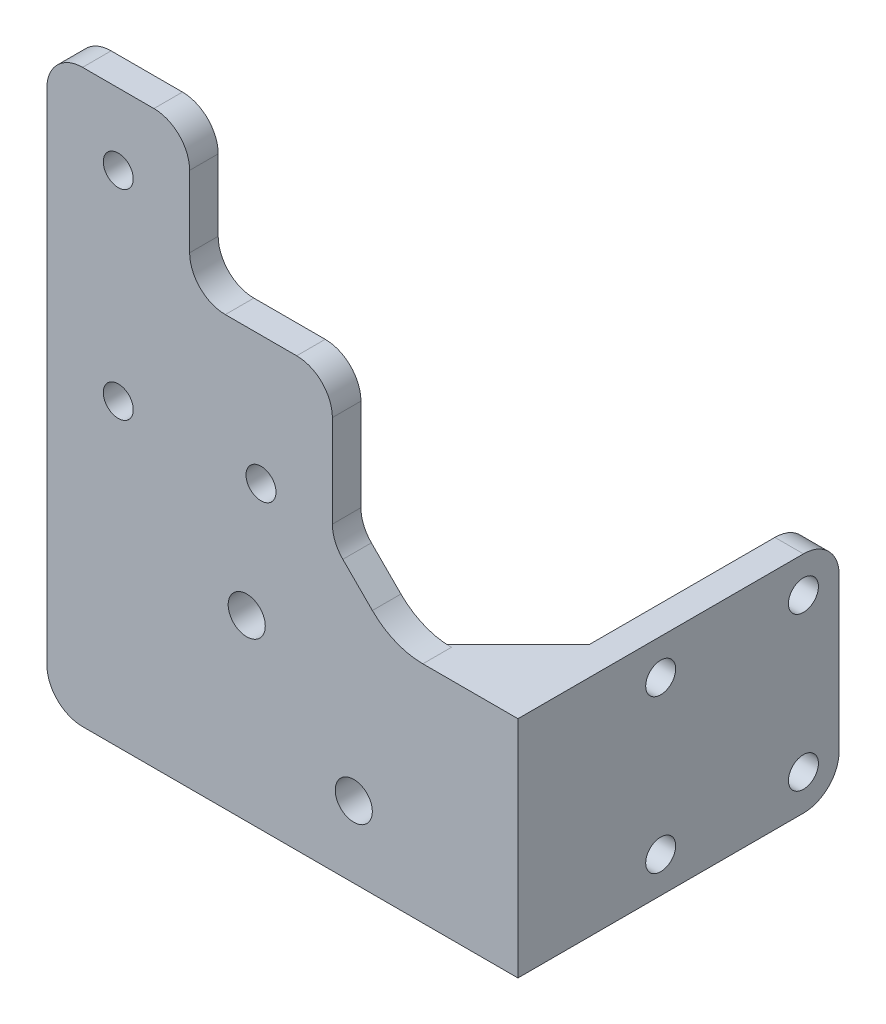
from build123d import *

# Parameters (mm, degrees)
MODEL_R         = 2.5999948
MODEL_R_2       = 2.0999958
EXTRUDE_1_DEPTH = 4
EXTRUDE_2_DEPTH = 4
FILLET_1_R      = 10
SKETCH_4_R      = 2.1
EXTRUDE_3_DEPTH = 4
EXTRUDE_4_DEPTH = 4


with BuildPart() as part:
    # Model → Бобышка-Вытянуть1 (new body)
    with BuildSketch(Plane.XY):
        with BuildLine():
            Line((308.392658055, 233.393719024), (308.392658055, 210.464832693))
            ThreePointArc((308.392658055, 210.464832693), (306.92819489, 206.929305859), (303.392668055, 205.464842693))
            Line((303.392668055, 205.464842693), (263.392748055, 205.464842693))
            ThreePointArc((263.392748055, 205.464842693), (259.85722122, 206.929305859), (258.392758055, 210.464832693))
            Line((258.392758055, 210.464832693), (258.392758055, 280.464692693))
            ThreePointArc((258.392758055, 280.464692693), (259.85722122, 284.000219528), (263.392748055, 285.464682693))
            Line((263.392748055, 285.464682693), (273.392728055, 285.464682693))
            ThreePointArc((273.392728055, 285.464682693), (276.92825489, 284.000219528), (278.392718055, 280.464692693))
            Line((278.392718055, 280.464692693), (278.392718055, 270.464712693))
            ThreePointArc((278.392718055, 270.464712693), (279.85718122, 266.929185859), (283.392708055, 265.464722693))
            Line((283.392708055, 265.464722693), (293.392688055, 265.464722693))
            ThreePointArc((293.392688055, 265.464722693), (296.92821489, 264.000259528), (298.392678055, 260.464732693))
            Line((298.392678055, 260.464732693), (298.392678055, 247.535826363))
            ThreePointArc((298.392678055, 247.535826363), (298.773279631, 245.622413028), (299.85714122, 244.000299528))
            Line((299.85714122, 244.000299528), (306.92819489, 236.929245859))
            ThreePointArc((306.92819489, 236.929245859), (308.012056479, 235.307132359), (308.392658055, 233.393719024))
        make_face()
        with Locations((286.392702055, 230.464792693)):
            Circle(MODEL_R, mode=Mode.SUBTRACT)
        with Locations((301.392672055, 215.464822693)):
            Circle(MODEL_R, mode=Mode.SUBTRACT)
        with Locations((268.392738055, 275.464702693)):
            Circle(MODEL_R_2, mode=Mode.SUBTRACT)
        with Locations((268.392738055, 247.464758693)):
            Circle(MODEL_R_2, mode=Mode.SUBTRACT)
        with Locations((288.392698055, 247.464758693)):
            Circle(MODEL_R_2, mode=Mode.SUBTRACT)
    extrude(amount=EXTRUDE_1_DEPTH)

    # Эскиз1 → Бобышка-Вытянуть2 (add)
    with BuildSketch(Plane(origin=(0, 0, 0), x_dir=(-1, 0, 0), z_dir=(0, 0, -1))):
        with BuildLine():
            Line((-308.392658055, 210.464832693), (-308.392658055, 232.615855145))
            Line((-308.392658055, 232.615855145), (-308.392658055, 233.393719024))
            ThreePointArc((-308.392658055, 233.393719024), (-308.012056479, 235.307132359), (-306.92819489, 236.929245859))
            Line((-306.92819489, 236.929245859), (-308.392658055, 236.929245859))
            Line((-308.392658055, 236.929245859), (-320.392658055, 236.929245859))
            Line((-320.392658055, 236.929245859), (-320.392658055, 205.464842693))
            Line((-320.392658055, 205.464842693), (-308.392658055, 205.464842693))
            Line((-308.392658055, 205.464842693), (-303.392668055, 205.464842693))
            ThreePointArc((-303.392668055, 205.464842693), (-306.92819489, 206.929305859), (-308.392658055, 210.464832693))
        make_face()
    extrude(amount=-EXTRUDE_2_DEPTH)

    # Скругление1
    fillet_1_edges = [part.edges().sort_by_distance(p)[0] for p in [
        (306.92819489, 236.929245859, 2),
    ]]
    fillet(fillet_1_edges, radius=FILLET_1_R)

    # Эскиз4 → Бобышка-Вытянуть3 (add)
    with BuildSketch(Plane(origin=(320.392658055, 0, 0), x_dir=(0, 0, -1), z_dir=(1, 0, 0))):
        with BuildLine():
            Line((-4, 236.929245859), (36, 236.929245859))
            ThreePointArc((36, 236.929245859), (39.535533906, 235.464779764), (41, 231.929245859))
            Line((41, 231.929245859), (41, 210.464842693))
            ThreePointArc((41, 210.464842693), (39.535533906, 206.929308787), (36, 205.464842693))
            Line((36, 205.464842693), (-4, 205.464842693))
            Line((-4, 205.464842693), (-4, 236.929245859))
        make_face()
        with Locations((36, 231.929245859)):
            Circle(SKETCH_4_R, mode=Mode.SUBTRACT)
        with Locations((36, 210.464842693)):
            Circle(SKETCH_4_R, mode=Mode.SUBTRACT)
        with Locations((16, 231.929245859)):
            Circle(SKETCH_4_R, mode=Mode.SUBTRACT)
        with Locations((16, 210.464842693)):
            Circle(SKETCH_4_R, mode=Mode.SUBTRACT)
    extrude(amount=EXTRUDE_3_DEPTH)

    # Эскиз5 → Бобышка-Вытянуть4 (add)
    with BuildSketch(Plane(origin=(0, 236.929245859, 0), x_dir=(1, 0, 0), z_dir=(0, 1, 0))):
        Polygon((320.392658055, 0), (320.392658055, 10), (310.392658055, 0), align=None)
    extrude_4 = extrude(amount=-EXTRUDE_4_DEPTH)

    # Зеркальное отражение1: Бобышка-Вытянуть4 across plane
    add(extrude_4.mirror(Plane.ZX.offset(221.197044276)))


solid = part.part
